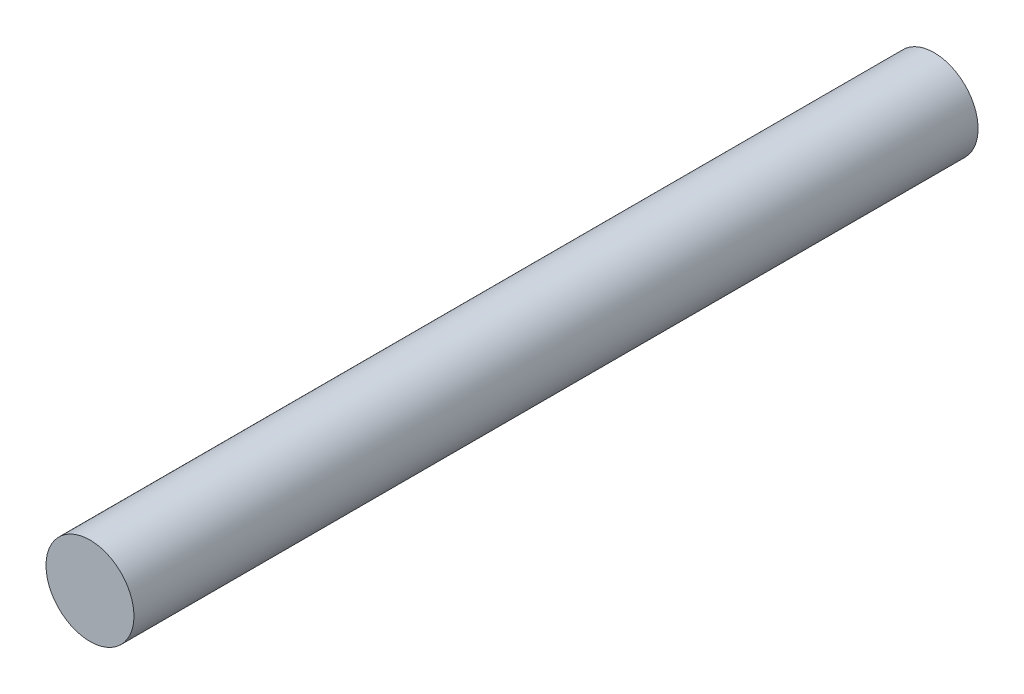
from build123d import *

# Parameters (mm, degrees)
SKETCH1_R           = 1.984375
BOSS_EXTRUDE1_DEPTH = 38.1


with BuildPart() as part:
    # Sketch1 → Boss-Extrude1 (new body)
    with BuildSketch(Plane.XY):
        Circle(SKETCH1_R)
    extrude(amount=BOSS_EXTRUDE1_DEPTH)


solid = part.part
